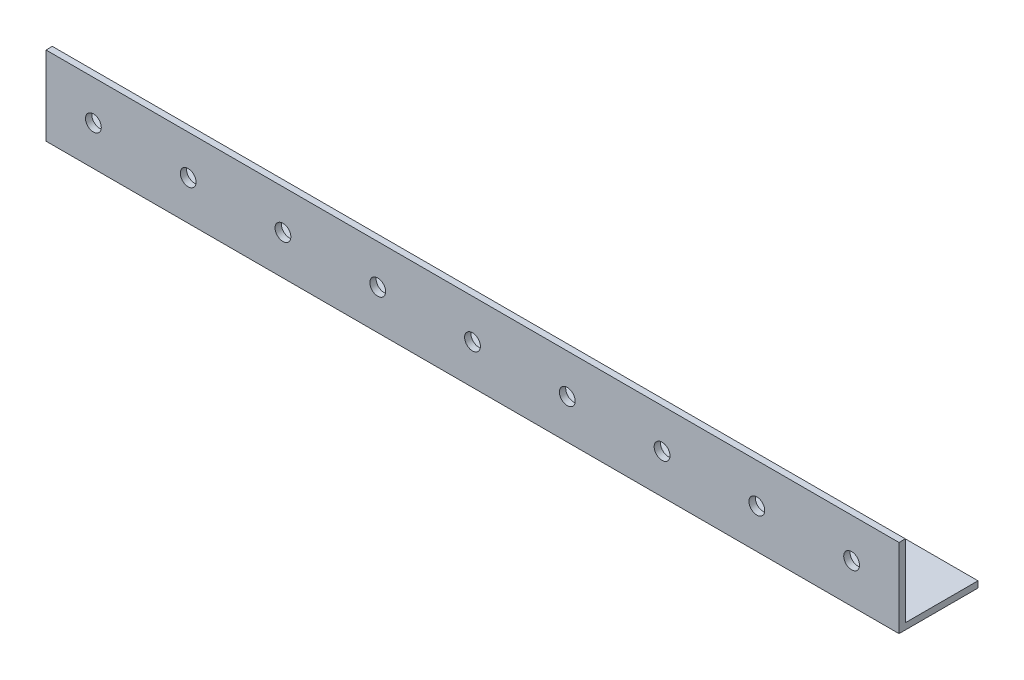
from build123d import *

# Parameters (mm, degrees)
EXTRUDE_1_DEPTH     = 540
SKETCH_2_R          = 5
CUT_EXTRUDE_1_DEPTH = 545.609952168
SKETCH_3_R          = 5
CUT_EXTRUDE_2_DEPTH = 545.609952168


with BuildPart() as part:
    # Эскиз1 → Вытянуть-Тонкостенный1 (new body)
    with BuildSketch(Plane(origin=(0, 0, 0), x_dir=(0, 0, -1), z_dir=(1, 0, 0))):
        Polygon((50, 0), (0, 0), (0, 50), (4, 50), (4, 4), (50, 4), align=None)
    extrude(amount=EXTRUDE_1_DEPTH)

    # Эскиз2 → Вырез-Вытянуть1 (cut, through all)
    with BuildSketch(Plane.XY):
        with Locations((30, 25)):
            Circle(SKETCH_2_R)
        with Locations((90, 25)):
            Circle(SKETCH_2_R)
        with Locations((150, 25)):
            Circle(SKETCH_2_R)
        with Locations((210, 25)):
            Circle(SKETCH_2_R)
        with Locations((270, 25)):
            Circle(SKETCH_2_R)
        with Locations((330, 25)):
            Circle(SKETCH_2_R)
        with Locations((390, 25)):
            Circle(SKETCH_2_R)
        with Locations((450, 25)):
            Circle(SKETCH_2_R)
        with Locations((510, 25)):
            Circle(SKETCH_2_R)
    extrude(amount=-CUT_EXTRUDE_1_DEPTH, mode=Mode.SUBTRACT)

    # Эскиз3 → Вырез-Вытянуть2 (cut, through all)
    with BuildSketch(Plane.XZ):
        with Locations((30, -25)):
            Circle(SKETCH_3_R)
        with Locations((90, -25)):
            Circle(SKETCH_3_R)
        with Locations((150, -25)):
            Circle(SKETCH_3_R)
        with Locations((210, -25)):
            Circle(SKETCH_3_R)
        with Locations((270, -25)):
            Circle(SKETCH_3_R)
        with Locations((330, -25)):
            Circle(SKETCH_3_R)
        with Locations((390, -25)):
            Circle(SKETCH_3_R)
        with Locations((450, -25)):
            Circle(SKETCH_3_R)
        with Locations((510, -25)):
            Circle(SKETCH_3_R)
    extrude(amount=-CUT_EXTRUDE_2_DEPTH, mode=Mode.SUBTRACT)


solid = part.part
